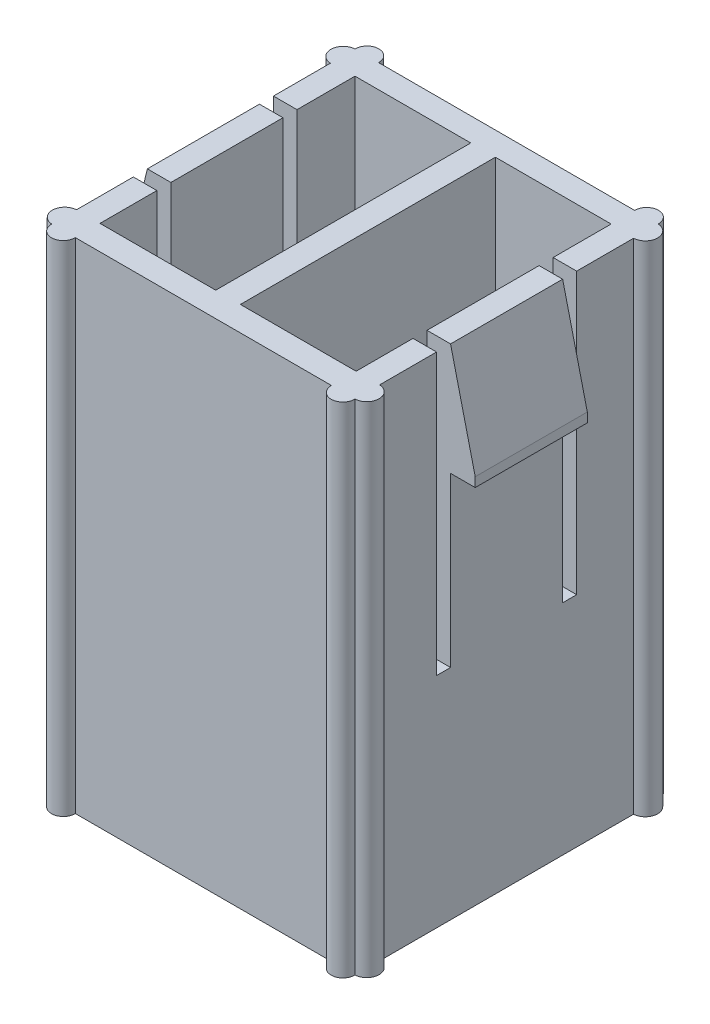
from build123d import *

# Parameters (mm, degrees)
SKETCH1_W            = 5.41
SKETCH1_H            = 5.41
SKETCH1_W_2          = 4.549942703
SKETCH1_H_2          = 4.549942703
SKETCH1_W_3          = 0.44
BOSS_EXTRUDE8_DEPTH  = 8.9
SKETCH2_W            = 0.25
SKETCH2_H            = 3.415060647
SKETCH2_H_2          = 1.584939353
CUT_EXTRUDE1_DEPTH   = 1
SKETCH3_W            = 2
SKETCH3_H            = 0.168194263
BOSS_EXTRUDE9_DEPTH  = 0.44
BOSS_EXTRUDE10_DEPTH = 2
SKETCH6_W            = 3.011984057
SKETCH6_H            = 5.99945952
CUT_EXTRUDE2_DEPTH   = 10


# Read off the part's stored shape, not the designer's step: Mirror10
with BuildPart() as part:
    # Sketch1 → Boss-Extrude8 (new body)
    # profile 1 of 10: a face of its own
    with BuildSketch(Plane(origin=(61.037479951, 0, 196.423934756), x_dir=(1, 0, 0), z_dir=(0, 1, 0))):
        with Locations((-39.807700339, 14.550827763)):
            Rectangle(SKETCH1_W, SKETCH1_H)
        with Locations((-39.797728988, 14.560799114)):
            Rectangle(SKETCH1_W_2, SKETCH1_H_2, mode=Mode.SUBTRACT)
    # profile 2 of 10: a face of its own
    with BuildSketch(Plane(origin=(61.037479951, 0, 196.423934756), x_dir=(1, 0, 0), z_dir=(0, 1, 0))):
        with Locations((-39.807700339, 14.560799114)):
            Rectangle(SKETCH1_W_3, SKETCH1_H_2)
    # profile 3 of 10: a face of its own
    with BuildSketch(Plane(origin=(61.037479951, 0, 196.423934756), x_dir=(1, 0, 0), z_dir=(0, 1, 0))):
        with BuildLine():
            ThreePointArc((-42.092643043, 17.255827763), (-42.302671691, 17.470827763), (-42.512700339, 17.255827763))
            Line((-42.512700339, 17.255827763), (-42.092643043, 17.255827763))
        make_face()
    # profile 4 of 10: a face of its own
    with BuildSketch(Plane(origin=(61.037479951, 0, 196.423934756), x_dir=(1, 0, 0), z_dir=(0, 1, 0))):
        with BuildLine():
            ThreePointArc((-42.512700339, 17.255827763), (-42.722700339, 17.035827763), (-42.512700339, 16.815827763))
            Line((-42.512700339, 16.815827763), (-42.512700339, 17.255827763))
        make_face()
    # profile 5 of 10: a face of its own
    with BuildSketch(Plane(origin=(61.037479951, 0, 196.423934756), x_dir=(1, 0, 0), z_dir=(0, 1, 0))):
        with BuildLine():
            ThreePointArc((-42.512700339, 12.285827763), (-42.722700339, 12.065827763), (-42.512700339, 11.845827763))
            Line((-42.512700339, 11.845827763), (-42.512700339, 12.285827763))
        make_face()
    # profile 6 of 10: a face of its own
    with BuildSketch(Plane(origin=(61.037479951, 0, 196.423934756), x_dir=(1, 0, 0), z_dir=(0, 1, 0))):
        with BuildLine():
            Line((-42.092643043, 11.845827763), (-42.512700339, 11.845827763))
            ThreePointArc((-42.512700339, 11.845827763), (-42.302671691, 11.630827763), (-42.092643043, 11.845827763))
        make_face()
    # profile 7 of 10: a face of its own
    with BuildSketch(Plane(origin=(61.037479951, 0, 196.423934756), x_dir=(1, 0, 0), z_dir=(0, 1, 0))):
        with BuildLine():
            Line((-37.102700339, 11.845827763), (-37.522757636, 11.845827763))
            ThreePointArc((-37.522757636, 11.845827763), (-37.312728988, 11.630827763), (-37.102700339, 11.845827763))
        make_face()
    # profile 8 of 10: a face of its own
    with BuildSketch(Plane(origin=(61.037479951, 0, 196.423934756), x_dir=(1, 0, 0), z_dir=(0, 1, 0))):
        with BuildLine():
            Line((-37.102700339, 12.285827763), (-37.102700339, 11.845827763))
            ThreePointArc((-37.102700339, 11.845827763), (-36.892700339, 12.065827763), (-37.102700339, 12.285827763))
        make_face()
    # profile 9 of 10: a face of its own
    with BuildSketch(Plane(origin=(61.037479951, 0, 196.423934756), x_dir=(1, 0, 0), z_dir=(0, 1, 0))):
        with BuildLine():
            ThreePointArc((-37.102700339, 17.255827763), (-37.312728988, 17.470827763), (-37.522757636, 17.255827763))
            Line((-37.522757636, 17.255827763), (-37.102700339, 17.255827763))
        make_face()
    # profile 10 of 10: a face of its own
    with BuildSketch(Plane(origin=(61.037479951, 0, 196.423934756), x_dir=(1, 0, 0), z_dir=(0, 1, 0))):
        with BuildLine():
            Line((-37.102700339, 17.255827763), (-37.102700339, 16.815827763))
            ThreePointArc((-37.102700339, 16.815827763), (-36.892700339, 17.035827763), (-37.102700339, 17.255827763))
        make_face()
    extrude(amount=BOSS_EXTRUDE8_DEPTH)

    # Sketch2 → Cut-Extrude1 (cut)
    with BuildSketch(Plane(origin=(23.934779612, 0, 196.423934756), x_dir=(0, 0, -1), z_dir=(1, 0, 0))):
        with Locations((13.425827763, 5.607530324)):
            Rectangle(SKETCH2_W, SKETCH2_H)
        with Locations((13.425827763, 8.107530324)):
            Rectangle(SKETCH2_W, SKETCH2_H_2)
        with Locations((15.675827763, 8.107530324)):
            Rectangle(SKETCH2_W, SKETCH2_H_2)
        with Locations((15.675827763, 5.607530324)):
            Rectangle(SKETCH2_W, SKETCH2_H)
    extrude(amount=-CUT_EXTRUDE1_DEPTH, mode=Mode.SUBTRACT)

    # Sketch3 → Boss-Extrude9 (add)
    with BuildSketch(Plane(origin=(23.934779612, 0, 196.423934756), x_dir=(0, 0, -1), z_dir=(1, 0, 0))):
        with Locations((14.550827763, 6.984097132)):
            Rectangle(SKETCH3_W, SKETCH3_H)
    extrude(amount=BOSS_EXTRUDE9_DEPTH)

    # Sketch5 → Boss-Extrude10 (add)
    with BuildSketch(Plane(origin=(61.037479951, 0, 182.873106993), x_dir=(1, 0, 0), z_dir=(0, 0, 1))):
        Polygon((-36.662700339, 7.068194263), (-37.102700339, 8.9), (-37.102700339, 7.068194263), align=None)
    extrude(amount=-BOSS_EXTRUDE10_DEPTH)

    # Sketch6 → Cut-Extrude2 (cut)
    with BuildSketch(Plane(origin=(61.037479951, 8.9, 196.423934756), x_dir=(1, 0, 0), z_dir=(0, 1, 0))):
        with Locations((-41.313692367, 14.541370124)):
            Rectangle(SKETCH6_W, SKETCH6_H)
    extrude(amount=-CUT_EXTRUDE2_DEPTH, mode=Mode.SUBTRACT)

    # Mirror10: part across plane


with BuildPart() as part_1:
    add(part.part)
    add(part.part.mirror(Plane(origin=(21.229779612, -1.1, 178.882834872), x_dir=(0, 0, 1), z_dir=(1, 0, 0))))


solid = part_1.part
